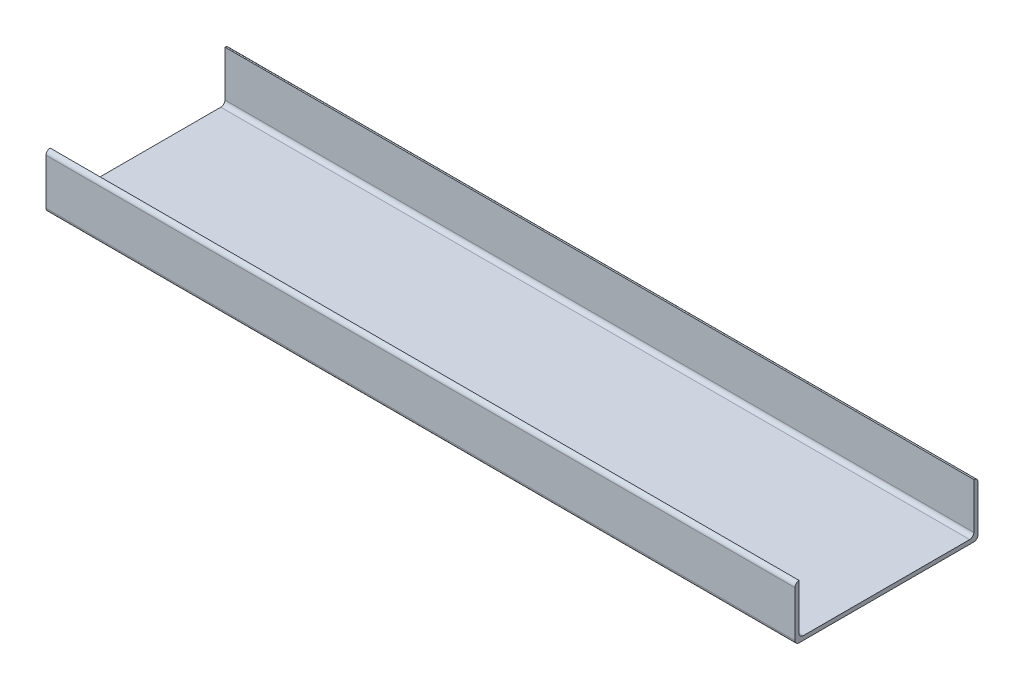
from build123d import *

# Parameters (mm, degrees)
SKETCH1_W           = 180
SKETCH1_H           = 44
BOSS_EXTRUDE1_DEPTH = 1
SKETCH2_W           = 180
SKETCH2_H           = 1
BOSS_EXTRUDE2_DEPTH = 12
FILLET1_R           = 1
FILLET2_R           = 1
FILLET3_R           = 1
FILLET4_R           = 1
FILLET5_R           = 1
FILLET6_R           = 1


with BuildPart() as part:
    # Sketch1 → Boss-Extrude1 (new body)
    with BuildSketch(Plane(origin=(0, 0, 0), x_dir=(1, 0, 0), z_dir=(0, 1, 0))):
        Rectangle(SKETCH1_W, SKETCH1_H)
    extrude(amount=BOSS_EXTRUDE1_DEPTH)

    # Sketch2 → Boss-Extrude2 (add)
    with BuildSketch(Plane(origin=(0, 1, 0), x_dir=(1, 0, 0), z_dir=(0, 1, 0))):
        with Locations((0, 21.5)):
            Rectangle(SKETCH2_W, SKETCH2_H)
        with Locations((0, -21.5)):
            Rectangle(SKETCH2_W, SKETCH2_H)
    extrude(amount=BOSS_EXTRUDE2_DEPTH)

    # Fillet1
    fillet1_edges = [part.edges().sort_by_distance(p)[0] for p in [
        (0, 13, 22),
    ]]
    fillet(fillet1_edges, radius=FILLET1_R - 0.0001)  # a hair under: the kernel refuses the full size

    # Fillet2
    fillet2_edges = [part.edges().sort_by_distance(p)[0] for p in [
        (0, 13, -22),
    ]]
    fillet(fillet2_edges, radius=FILLET2_R - 0.0001)  # a hair under: the kernel refuses the full size

    # Fillet3
    fillet3_edges = [part.edges().sort_by_distance(p)[0] for p in [
        (0, 1, -21),
    ]]
    fillet(fillet3_edges, radius=FILLET3_R)

    # Fillet4
    fillet4_edges = [part.edges().sort_by_distance(p)[0] for p in [
        (0, 1, 21),
    ]]
    fillet(fillet4_edges, radius=FILLET4_R)

    # Fillet5
    fillet5_edges = [part.edges().sort_by_distance(p)[0] for p in [
        (0, 0, 22),
    ]]
    fillet(fillet5_edges, radius=FILLET5_R)

    # Fillet6
    fillet6_edges = [part.edges().sort_by_distance(p)[0] for p in [
        (0, 0, -22),
    ]]
    fillet(fillet6_edges, radius=FILLET6_R)


solid = part.part
